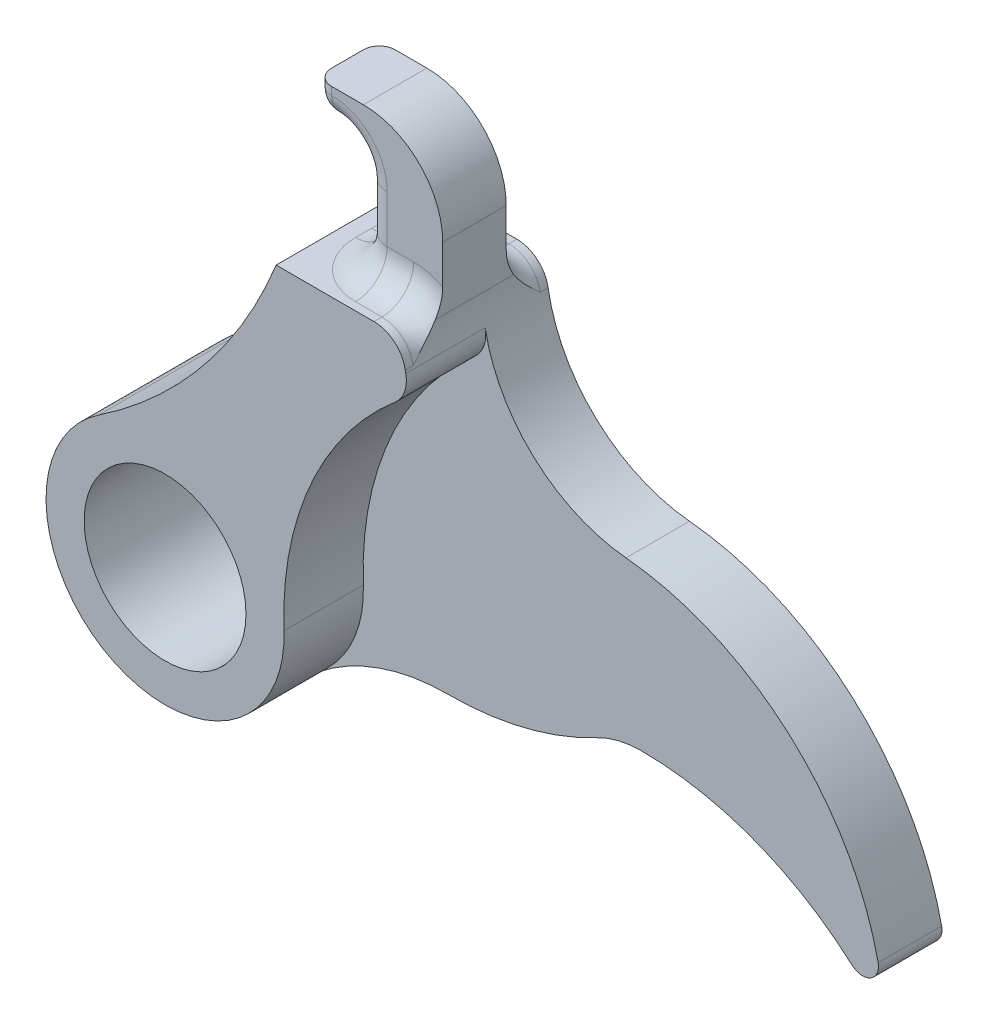
from build123d import *

# Parameters (mm, degrees)
EXTRUDE_1_DEPTH     = 9
CUT_EXTRUDE_START   = -5
CUT_EXTRUDE_1_DEPTH = 5
SKETCH_12_W         = 2.5
SKETCH_12_H         = 7
CUT_EXTRUDE_3_DEPTH = 42.911887352
FILLET_11_R         = 2
FILLET_1_R          = 1
SKETCH_10_W         = 8
SKETCH_10_H         = 4
EXTRUDE_3_DEPTH     = 2
FILLET_5_R          = 5
FILLET_10_R         = 7.5
FILLET_14_R         = 2
FILLET_15_R         = 1.5
FILLET_16_R         = 2
FILLET_17_R         = 1
FILLET_18_R         = 2
SKETCH_11_R         = 5.1
CUT_EXTRUDE_2_DEPTH = 44.514365603


# Some blends are built 0.0001 mm under size
with BuildPart() as part:
    # Эскиз2 → Бобышка-Вытянуть1 (new body)
    with BuildSketch(Plane.XY):
        with BuildLine():
            Line((-18, 0), (-15, 0))
            Line((-15, 0), (-15, 7))
            Line((-15, 7), (-10, 7))
            Line((-10, 7), (-10, 0))
            ThreePointArc((-10, 0), (-7.39984978, -6.726233956), (-0.951555354, -9.954624172))
            ThreePointArc((-0.951555354, -9.954624172), (10.407523967, -15.498539394), (15.320888862, -27.144247806))
            ThreePointArc((15.320888862, -27.144247806), (8.452365235, -21.873844259), (0, -20))
            ThreePointArc((0, -20), (-1.44344914, -20.176216472), (-2.802111775, -20.69451514))
            ThreePointArc((-2.802111775, -20.69451514), (-7.346697493, -22.426064476), (-12.174852362, -23.009539415))
            ThreePointArc((-12.174852362, -23.009539415), (-16.488233618, -23.738589268), (-20.315570084, -25.857142338))
            ThreePointArc((-20.315570084, -25.857142338), (-31.05163084, -24.430323259), (-29.168151763, -13.764896883))
            ThreePointArc((-29.168151763, -13.764896883), (-22.544234788, -7.726123715), (-18, 0))
        make_face()
    extrude(amount=EXTRUDE_1_DEPTH)

    # Эскиз6 → Вырез-Вытянуть1 (cut)
    with BuildSketch(Plane.XY.offset(9).offset(CUT_EXTRUDE_START)):
        with BuildLine():
            ThreePointArc((-9.55, -2.96605799), (-16.390256677, -12.316180922), (-16.898984287, -23.890078556))
            ThreePointArc((-16.898984287, -23.890078556), (-14.577958647, -23.229625817), (-12.174852362, -23.009539415))
            ThreePointArc((-12.174852362, -23.009539415), (-7.346697493, -22.426064476), (-2.802111775, -20.69451514))
            ThreePointArc((-2.802111775, -20.69451514), (-1.44344914, -20.176216472), (0, -20))
            ThreePointArc((0, -20), (8.452365235, -21.873844259), (15.320888862, -27.144247806))
            ThreePointArc((15.320888862, -27.144247806), (10.407523967, -15.498539394), (-0.951555354, -9.954624172))
            ThreePointArc((-0.951555354, -9.954624172), (-6.307192762, -7.760110789), (-9.55, -2.96605799))
        make_face()
    extrude(amount=CUT_EXTRUDE_1_DEPTH, mode=Mode.SUBTRACT)

    # Эскиз12 → Вырез-Вытянуть3 (cut, through all)
    with BuildSketch(Plane.ZY.offset(15)):
        with Locations((1.25, 3.5)):
            Rectangle(SKETCH_12_W, SKETCH_12_H)
        with Locations((7.75, 3.5)):
            Rectangle(SKETCH_12_W, SKETCH_12_H)
    extrude(amount=-CUT_EXTRUDE_3_DEPTH, mode=Mode.SUBTRACT)

    # Скругление11
    fillet_11_edges = [part.edges().sort_by_distance(p)[0] for p in [
        (-10, 0, 7.75),
        (-10, 0, 1.25),
    ]]
    fillet(fillet_11_edges, radius=FILLET_11_R)

    # Скругление1
    fillet_1_edges = [part.edges().sort_by_distance(p)[0] for p in [
        (15.320888862, -27.144247806, 2),
    ]]
    fillet(fillet_1_edges, radius=FILLET_1_R)

    # Эскиз10 → Бобышка-Вытянуть3 (add)
    with BuildSketch(Plane(origin=(0, 7, 0), x_dir=(-1, 0, 0), z_dir=(0, 1, 0))):
        with Locations((14, 4.5)):
            Rectangle(SKETCH_10_W, SKETCH_10_H)
    extrude(amount=EXTRUDE_3_DEPTH)

    # Скругление5
    fillet_5_edges = [part.edges().sort_by_distance(p)[0] for p in [
        (-10, 9, 4.5),
    ]]
    fillet(fillet_5_edges, radius=FILLET_5_R)

    # Скругление10
    fillet_10_edges = [part.edges().sort_by_distance(p)[0] for p in [
        (-16.898984287, -23.890078556, 6.5),
    ]]
    fillet(fillet_10_edges, radius=FILLET_10_R - 0.0001)  # a hair under: the kernel refuses the full size

    # Скругление14
    fillet_14_edges = [part.edges().sort_by_distance(p)[0] for p in [
        (-15, 7, 4.5),
    ]]
    fillet(fillet_14_edges, radius=FILLET_14_R)

    # Скругление15
    fillet_15_edges = [part.edges().sort_by_distance(p)[0] for p in [
        (-17.5, 7, 6.5),
        (-15, 2.5, 6.5),
        (-17.5, 7, 2.5),
        (-15.585786438, 6.414213562, 2.5),
        (-15.585786438, 6.414213562, 6.5),
        (-15, 2.5, 2.5),
    ]]
    fillet(fillet_15_edges, radius=FILLET_15_R)

    # Скругление16
    # the kernel refuses this fillet: 2 mm, written as the material it adds along each edge
    with BuildSketch(Plane(origin=(-11.832159566, -2, 6.5), x_dir=(-0.6907726827654878, -0.7230719886325089, 0), z_dir=(-0.7230719886325089, 0.6907726827654878, 0))) as fillet_16_piece_1_section:
        with BuildLine():
            CenterArc((2 + FILLET_16_R, FILLET_16_R), FILLET_16_R, 180, 90)
            Line((2, FILLET_16_R), (2, 0))
            Line((2, 0), (2 + FILLET_16_R, 0))
        make_face()
    fillet_16_piece_1 = revolve(axis=Axis((-11.832159566, -2, 6.5), (0, 0, 1)), revolution_arc=223.691304566, mode=Mode.PRIVATE)
    fillet_16_piece_1 = split(fillet_16_piece_1, bisect_by=Plane(origin=(-9.962064569, 0, 7.231915875), z_dir=(0, -1, 0)), keep=Keep.TOP, mode=Mode.PRIVATE)
    fillet_16_piece_1 = fillet_16_piece_1 - Plane(origin=(0, 0, 7.231915875), x_dir=(-1, 0, 0), z_dir=(0, 0, -1)) * Cylinder(10, 17, mode=Mode.PRIVATE)
    fillet_16_piece_1 = fillet_16_piece_1 - Plane(origin=(2.479707116, -18.943734501, 7.231915875), x_dir=(-0.6014853558135568, 0.7988838255602869, 0), z_dir=(0, 0, -1)) * Cylinder(20, 17, mode=Mode.PRIVATE)
    add(fillet_16_piece_1)
    with BuildSketch(Plane(origin=(-11.832159566, -2, 6.5), x_dir=(-0.6907726827654878, -0.7230719886325089, 0), z_dir=(-0.7230719886325089, 0.6907726827654878, 0))) as fillet_16_piece_2_section:
        with BuildLine():
            CenterArc((2 + FILLET_16_R, FILLET_16_R), FILLET_16_R, 180, 90)
            Line((2, FILLET_16_R), (2, 0))
            Line((2, 0), (2 + FILLET_16_R, 0))
        make_face()
    fillet_16_piece_2 = revolve(axis=Axis((-11.832159566, -2, 6.5), (0, 0, 1)), revolution_arc=223.691304566, mode=Mode.PRIVATE)
    fillet_16_piece_2 = split(fillet_16_piece_2, bisect_by=Plane(origin=(-11.088968436, 0, 6.841402023), z_dir=(0, 1, 0)), keep=Keep.TOP, mode=Mode.PRIVATE)
    fillet_16_piece_2 = split(fillet_16_piece_2, bisect_by=Plane(origin=(-10, 0.441530369, 6.841402023), z_dir=(-1, 0, 0)), keep=Keep.TOP, mode=Mode.PRIVATE)
    add(fillet_16_piece_2)
    with BuildSketch(Plane(origin=(-13.5, 0, 6.5), x_dir=(0, 0, 1), z_dir=(1, 0, 0))) as fillet_16_piece_3:
        with BuildLine():
            CenterArc((FILLET_16_R, -FILLET_16_R), FILLET_16_R, 90, 90)
            Line((0, -FILLET_16_R), (0, 0))
            Line((0, 0), (FILLET_16_R, 0))
        make_face()
    extrude(amount=1.667840434)
    with BuildSketch(Plane(origin=(-11.832159566, -2, 2.5), x_dir=(-0.6907726827654875, -0.7230719886325091, 0), z_dir=(-0.7230719886325091, 0.6907726827654875, 0))) as fillet_16_piece_4_section:
        with BuildLine():
            CenterArc((2 + FILLET_16_R, -FILLET_16_R), FILLET_16_R, 90, 90)
            Line((2, -FILLET_16_R), (2, 0))
            Line((2, 0), (2 + FILLET_16_R, 0))
        make_face()
    fillet_16_piece_4 = revolve(axis=Axis((-11.832159566, -2, 2.5), (0, 0, 1)), revolution_arc=223.691304566, mode=Mode.PRIVATE)
    fillet_16_piece_4 = split(fillet_16_piece_4, bisect_by=Plane(origin=(-9.962064569, 0, 1.768084125), z_dir=(0, -1, 0)), keep=Keep.TOP, mode=Mode.PRIVATE)
    fillet_16_piece_4 = fillet_16_piece_4 - Plane(origin=(0, 0, 1.768084125), x_dir=(-1, 0, 0), z_dir=(0, 0, -1)) * Cylinder(10, 17, mode=Mode.PRIVATE)
    add(fillet_16_piece_4)
    with BuildSketch(Plane(origin=(-11.832159566, -2, 2.5), x_dir=(-0.6907726827654875, -0.7230719886325091, 0), z_dir=(-0.7230719886325091, 0.6907726827654875, 0))) as fillet_16_piece_5_section:
        with BuildLine():
            CenterArc((2 + FILLET_16_R, -FILLET_16_R), FILLET_16_R, 90, 90)
            Line((2, -FILLET_16_R), (2, 0))
            Line((2, 0), (2 + FILLET_16_R, 0))
        make_face()
    fillet_16_piece_5 = revolve(axis=Axis((-11.832159566, -2, 2.5), (0, 0, 1)), revolution_arc=223.691304566, mode=Mode.PRIVATE)
    fillet_16_piece_5 = split(fillet_16_piece_5, bisect_by=Plane(origin=(-10, 0.441530341, 2.15859789), z_dir=(-1, 0, 0)), keep=Keep.TOP, mode=Mode.PRIVATE)
    add(fillet_16_piece_5)
    with BuildSketch(Plane(origin=(-13.5, 0, 2.5), x_dir=(0, 0, -1), z_dir=(1, 0, 0))) as fillet_16_piece_6:
        with BuildLine():
            CenterArc((FILLET_16_R, FILLET_16_R), FILLET_16_R, 180, 90)
            Line((0, FILLET_16_R), (0, 0))
            Line((0, 0), (FILLET_16_R, 0))
        make_face()
    extrude(amount=1.667840434)
    with BuildSketch(Plane(origin=(-13.5, 0, 4), x_dir=(0, 0, -1), z_dir=(1, 0, 0))) as fillet_16_piece_7:
        with BuildLine():
            CenterArc((1.5 + FILLET_16_R, FILLET_16_R), FILLET_16_R, 180, 90)
            Line((1.5 + FILLET_16_R, 0), (1.5, 0))
            Line((1.5, 0), (1.5, FILLET_16_R))
        make_face()
    revolve(axis=Axis((-13.5, 0, 4), (0, 1, 0)), revolution_arc=90)
    with BuildSketch(Plane(origin=(-15, 0, 4), x_dir=(0, 1, 0), z_dir=(0, 0, 1))) as fillet_16_piece_8:
        with BuildLine():
            CenterArc((FILLET_16_R, FILLET_16_R), FILLET_16_R, 180, 90)
            Line((0, FILLET_16_R), (0, 0))
            Line((0, 0), (FILLET_16_R, 0))
        make_face()
    extrude(amount=1)
    with BuildSketch(Plane(origin=(-13.5, 0, 5), x_dir=(0, 0, 1), z_dir=(1, 0, 0))) as fillet_16_piece_9:
        with BuildLine():
            CenterArc((1.5 + FILLET_16_R, -FILLET_16_R), FILLET_16_R, 90, 90)
            Line((1.5 + FILLET_16_R, 0), (1.5, 0))
            Line((1.5, 0), (1.5, -FILLET_16_R))
        make_face()
    revolve(axis=Axis((-13.5, 0, 5), (0, -1, 0)), revolution_arc=90)

    # Скругление17
    fillet_17_edges = [part.edges().sort_by_distance(p)[0] for p in [
        (-18, 8.75, 2.5),
        (-18, 7.439339828, 2.939339828),
        (-18, 7, 4.5),
        (-18, 8.75, 6.5),
        (-18, 7.439339828, 6.060660172),
    ]]
    fillet(fillet_17_edges, radius=FILLET_17_R - 0.0001)  # a hair under: the kernel refuses the full size

    # Скругление18
    fillet_18_edges = [part.edges().sort_by_distance(p)[0] for p in [
        (-9.55, -2.96605799, 5.25),
    ]]
    fillet(fillet_18_edges, radius=FILLET_18_R)

    # Эскиз11 → Вырез-Вытянуть2 (cut, through all)
    with BuildSketch(Plane.XY.offset(9)):
        with Locations((-25, -20)):
            Circle(SKETCH_11_R)
    extrude(amount=-CUT_EXTRUDE_2_DEPTH, mode=Mode.SUBTRACT)


solid = part.part
